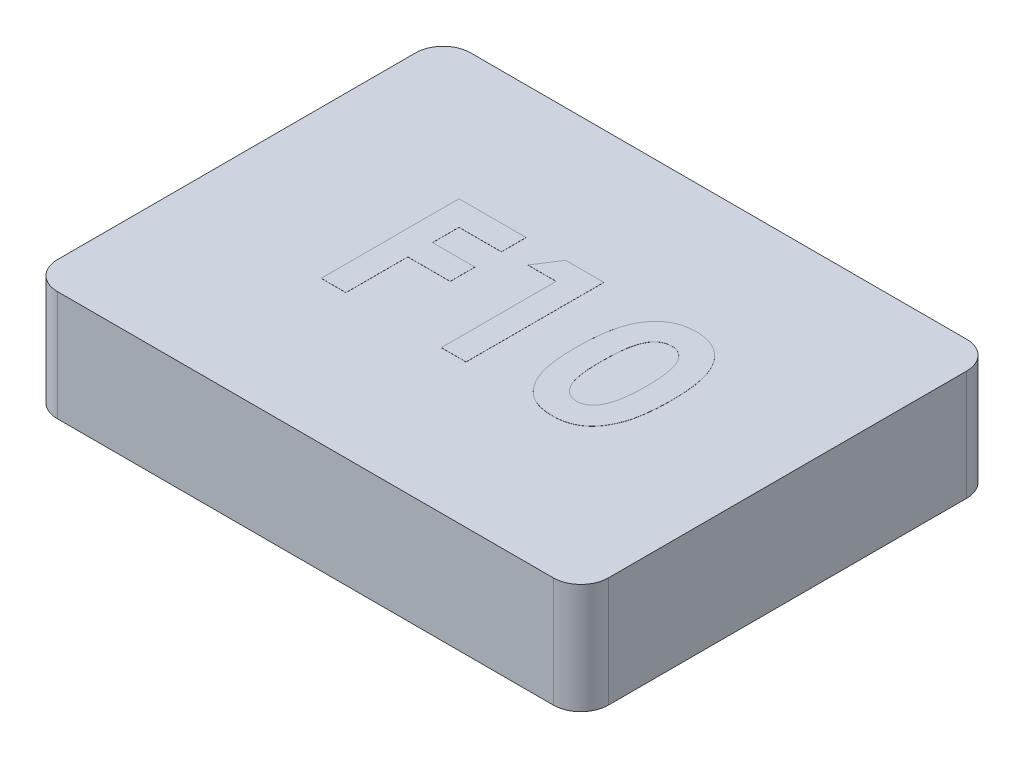
from build123d import *

# Parameters (mm, degrees)
SKETCH1_W           = 12.7
SKETCH1_H           = 9.525
BOSS_EXTRUDE1_DEPTH = 2.54
FILLET1_R           = 0.635
SHELL1_START        = 0.635
SHELL1_OUTLINE_W    = 1.905
SHELL1_OUTLINE_H    = 8.255
SHELL1_DEPTH        = 11.43
SKETCH2_R           = 2.54
BOSS_EXTRUDE2_DEPTH = 1.905
BOSS_EXTRUDE3_DEPTH = 0.00254


# Read off the part's stored shape, not the designer's step: Shell1
with BuildPart() as part:
    # Sketch1 → Boss-Extrude1 (new body)
    with BuildSketch(Plane(origin=(0, 0, 0), x_dir=(1, 0, 0), z_dir=(0, 1, 0))):
        with Locations((6.35, 4.7625)):
            Rectangle(SKETCH1_W, SKETCH1_H)
    extrude(amount=BOSS_EXTRUDE1_DEPTH)

    # Fillet1
    fillet1_edges = [part.edges().sort_by_distance(p)[0] for p in [
        (0, 1.27, -9.525),
        (12.7, 1.27, -9.525),
        (12.7, 1.27, 0),
        (0, 1.27, 0),
    ]]
    fillet(fillet1_edges, radius=FILLET1_R)

    # Shell1 outline → Shell1 (cut)
    with BuildSketch(Plane.YZ.offset(SHELL1_START)):
        with Locations((0.9525, -4.7625)):
            Rectangle(SHELL1_OUTLINE_W, SHELL1_OUTLINE_H)
    extrude(amount=SHELL1_DEPTH, mode=Mode.SUBTRACT)

    # Sketch2 → Boss-Extrude2 (add)
    with BuildSketch(Plane(origin=(0, 1.905, 0), x_dir=(-1, 0, 0), z_dir=(0, -1, 0))):
        with Locations(Location((-6.35, 4.7625, 0), (0, 0, 270))):
            Circle(SKETCH2_R)
    extrude(amount=BOSS_EXTRUDE2_DEPTH)

    # Sketch3 → Boss-Extrude3 (add)
    # profile 1 of 3: a face of its own
    with BuildSketch(Plane(origin=(0, 2.54, 0), x_dir=(1, 0, 0), z_dir=(0, 1, 0))):
        Polygon((3.414346154, 6.477), (4.961141026, 6.477), (4.961141026, 5.907128205), (3.984217949, 5.907128205), (3.984217949, 5.296551282), (4.961141026, 5.296551282), (4.961141026, 4.726679487), (3.984217949, 4.726679487), (3.984217949, 3.302), (3.414346154, 3.302), align=None)
    # profile 2 of 3: a face of its own
    with BuildSketch(Plane(origin=(0, 2.54, 0), x_dir=(1, 0, 0), z_dir=(0, 1, 0))):
        Polygon((5.871282252, 6.477), (6.752166667, 6.477), (6.752166667, 3.302), (6.182294872, 3.302), (6.182294872, 5.947833333), (5.531012821, 5.947833333), align=None)
    # profile 3 of 3: a face of its own
    with BuildSketch(Plane(origin=(0, 2.54, 0), x_dir=(1, 0, 0), z_dir=(0, 1, 0))):
        with BuildLine():
            add(Edge.make_bspline(
                [(8.798235377, 6.558410256), (8.825819537, 6.558000762), (8.880057365, 6.557195586), (8.959939478, 6.548474876), (9.036888038, 6.535300314), (9.111204078, 6.516926396), (9.182352664, 6.492609168), (9.25085163, 6.463501864), (9.31588564, 6.428077745), (9.378284086, 6.388064384), (9.438022931, 6.342763586), (9.493666394, 6.291118337), (9.546230643, 6.234316997), (9.594577855, 6.171500832), (9.639778695, 6.10324122), (9.68168464, 6.029527338), (9.719974889, 5.949998406), (9.755078585, 5.864510908), (9.786468421, 5.771783423), (9.812908041, 5.670752326), (9.83558444, 5.561394546), (9.85472492, 5.443437874), (9.869192029, 5.316725518), (9.878943152, 5.181341659), (9.885634834, 5.037547297), (9.886180963, 4.938905546), (9.886461538, 4.888227965)],
                knots=[0, 0, 0, 0, 0.879237366, 1.728815576, 2.559023295, 3.367336655, 4.166867292, 4.954216142, 5.737608147, 6.525189134, 7.316157332, 8.124696809, 8.942788509, 9.781158001, 10.649253743, 11.551476218, 12.482711956, 13.461909668, 14.496590415, 15.601789533, 16.789733467, 18.056700938, 19.410929216, 20.8549011, 22.384193279, 24, 24, 24, 24], degree=3))
            add(Edge.make_bspline(
                [(9.886461538, 4.888227965), (9.886158312, 4.83691635), (9.885569149, 4.737218804), (9.879221327, 4.592109226), (9.86829008, 4.455742398), (9.854201098, 4.32813243), (9.834903048, 4.20934671), (9.812302348, 4.099077662), (9.785445387, 3.997365257), (9.75302158, 3.904438674), (9.718130367, 3.818801041), (9.679735377, 3.739427172), (9.63850583, 3.666102077), (9.595387407, 3.59771955), (9.548016197, 3.53629547), (9.498697891, 3.4797411), (9.445285081, 3.430210667), (9.390026654, 3.385151595), (9.330898269, 3.346211514), (9.268509703, 3.312155161), (9.201748675, 3.284531414), (9.131832125, 3.260505754), (9.057568312, 3.243257923), (8.980137277, 3.229572336), (8.89866484, 3.222008841), (8.843195123, 3.221070539), (8.814771835, 3.220589744)],
                knots=[0, 0, 0, 0, 1.643780988, 3.193836972, 4.651895693, 6.025988579, 7.305620092, 8.505800249, 9.631074763, 10.672816429, 11.65661981, 12.592235626, 13.49536222, 14.350718032, 15.179365177, 15.97804903, 16.751647189, 17.51006938, 18.259804725, 19.016521909, 19.783502495, 20.571750527, 21.382245291, 22.22305063, 23.089471752, 24, 24, 24, 24], degree=3))
            add(Edge.make_bspline(
                [(8.814771835, 3.220589744), (8.786349314, 3.221079814), (8.730670013, 3.222039854), (8.648977266, 3.229516098), (8.571135886, 3.243313364), (8.496284527, 3.26063817), (8.424944142, 3.284478255), (8.356772657, 3.312928485), (8.292294252, 3.346772343), (8.231330396, 3.38580315), (8.174089237, 3.430560743), (8.119681247, 3.480566389), (8.068226781, 3.535693336), (8.020508587, 3.596559051), (7.975745182, 3.662351105), (7.934403375, 3.733820811), (7.896508012, 3.810864109), (7.86087372, 3.893588392), (7.82991203, 3.983774617), (7.802357564, 4.082228137), (7.779785671, 4.189769642), (7.761631843, 4.306364584), (7.747137838, 4.431765951), (7.736355964, 4.566034271), (7.729972884, 4.709232083), (7.729389899, 4.807659072), (7.729089744, 4.858335136)],
                knots=[0, 0, 0, 0, 0.917216111, 1.796812873, 2.643793957, 3.46689424, 4.273913431, 5.068098542, 5.848489301, 6.620921603, 7.401012384, 8.190319798, 9.003608147, 9.831726257, 10.68377682, 11.569763213, 12.493818149, 13.453288342, 14.474581811, 15.568529029, 16.750744269, 18.018426408, 19.375425659, 20.823733699, 22.36466933, 24, 24, 24, 24], degree=3))
            add(Edge.make_bspline(
                [(7.729089744, 4.858335136), (7.729633447, 4.928745538), (7.730682529, 5.064603314), (7.74397727, 5.2608783), (7.763490579, 5.442300526), (7.792151006, 5.608566515), (7.827589229, 5.760292069), (7.872969718, 5.896477699), (7.924632103, 6.019007839), (7.968655093, 6.091595432), (7.989856971, 6.126554287)],
                knots=[0, 0, 0, 0, 1.288568992, 2.486310467, 3.599230591, 4.627010532, 5.572937695, 6.447898582, 7.252493626, 8, 8, 8, 8], degree=3))
            add(Edge.make_bspline(
                [(7.989856971, 6.126554287), (8.014509505, 6.160897855), (8.062710067, 6.228046298), (8.146990098, 6.316199652), (8.237538017, 6.391592717), (8.336213628, 6.452519281), (8.441456335, 6.500565973), (8.5541697, 6.534500812), (8.673937491, 6.554272829), (8.756184031, 6.557010519), (8.798235377, 6.558410256)],
                knots=[0, 0, 0, 0, 1.058512271, 2.069600068, 3.047294572, 4.004278952, 4.967380941, 5.939006123, 6.946246673, 8, 8, 8, 8], degree=3))
        make_face()
        with BuildLine():
            add(Edge.make_bspline(
                [(8.812227764, 5.988538462), (8.787291455, 5.98735653), (8.738403051, 5.985039317), (8.667463648, 5.965369447), (8.600572221, 5.934988272), (8.549689698, 5.898429277), (8.511604636, 5.863383097), (8.48499433, 5.831667444), (8.459332884, 5.796275061), (8.436667403, 5.755608871), (8.415265272, 5.711130059), (8.394348939, 5.662636719), (8.377203038, 5.608937747), (8.360357645, 5.550947646), (8.345599509, 5.487063142), (8.333235426, 5.41676205), (8.322189206, 5.339587196), (8.314484335, 5.25548803), (8.307301083, 5.164552541), (8.302151788, 5.06657816), (8.299998997, 4.961591317), (8.29931469, 4.889288437), (8.298961538, 4.85197496)],
                knots=[0, 0, 0, 0, 1.076674018, 2.110852608, 3.161083442, 4.239746716, 4.804137807, 5.395870207, 6.026861976, 6.692161227, 7.405688833, 8.16177676, 8.973626916, 9.841385931, 10.773283133, 11.807421078, 12.927755683, 14.143907515, 15.458935494, 16.872852025, 18.386167141, 20, 20, 20, 20], degree=3))
            add(Edge.make_bspline(
                [(8.298961538, 4.85197496), (8.299542783, 4.803633547), (8.300657362, 4.710935302), (8.306495007, 4.577631999), (8.318196082, 4.45631526), (8.332749856, 4.346162875), (8.353191227, 4.247889213), (8.376710347, 4.160564514), (8.405754369, 4.085301955), (8.439320333, 4.02101307), (8.476496151, 3.96632265), (8.516852136, 3.919835547), (8.559014312, 3.879579908), (8.604298698, 3.846880749), (8.652597258, 3.821821621), (8.70350679, 3.803796899), (8.757059643, 3.792763217), (8.793732086, 3.7912332), (8.812227764, 3.790461538)],
                knots=[0, 0, 0, 0, 1.771748488, 3.397459088, 4.888034009, 6.237357457, 7.467047327, 8.564189669, 9.548206622, 10.417051504, 11.216568818, 11.965764335, 12.669334354, 13.348544111, 14.005342236, 14.656555988, 15.322436492, 16, 16, 16, 16], degree=3))
            add(Edge.make_bspline(
                [(8.812227764, 3.790461538), (8.83008873, 3.790989566), (8.86505828, 3.79202338), (8.916051715, 3.802635332), (8.96427473, 3.819888063), (9.009581726, 3.844293261), (9.052134759, 3.875328205), (9.091725856, 3.913129275), (9.128056429, 3.95807326), (9.149222786, 3.991428344), (9.160129407, 4.008615585)],
                knots=[0, 0, 0, 0, 0.992283464, 1.942767638, 2.88273346, 3.832339453, 4.79467288, 5.803907806, 6.868395428, 8, 8, 8, 8], degree=3))
            add(Edge.make_bspline(
                [(9.160129407, 4.008615585), (9.172970117, 4.0321014), (9.199896044, 4.08134925), (9.231054773, 4.164453161), (9.257282455, 4.258180636), (9.279856237, 4.362823366), (9.295295327, 4.478794074), (9.308591452, 4.60535738), (9.315004504, 4.743150605), (9.316047621, 4.838614248), (9.316589744, 4.888227965)],
                knots=[0, 0, 0, 0, 0.710965849, 1.490837728, 2.352621235, 3.297892224, 4.334225155, 5.461620853, 6.680770821, 8, 8, 8, 8], degree=3))
            add(Edge.make_bspline(
                [(9.316589744, 4.888227965), (9.316380334, 4.938272352), (9.315977255, 5.034599256), (9.30858193, 5.172887857), (9.298283374, 5.299191543), (9.283219561, 5.41322833), (9.263837227, 5.515275048), (9.239948427, 5.605325026), (9.211785309, 5.683555737), (9.178387208, 5.749889172), (9.141396735, 5.806263493), (9.10213022, 5.854628288), (9.060421626, 5.895920929), (9.016340704, 5.930296808), (8.968867186, 5.956562559), (8.918907879, 5.975108351), (8.866360361, 5.986327934), (8.830515514, 5.987791673), (8.812227764, 5.988538462)],
                knots=[0, 0, 0, 0, 1.793836731, 3.452829483, 4.963243077, 6.335886805, 7.574563692, 8.684454726, 9.672768357, 10.54971625, 11.340229787, 12.085688095, 12.778991901, 13.440269426, 14.083255152, 14.715733572, 15.344777694, 16, 16, 16, 16], degree=3))
        make_face(mode=Mode.SUBTRACT)
    extrude(amount=BOSS_EXTRUDE3_DEPTH)


solid = part.part
